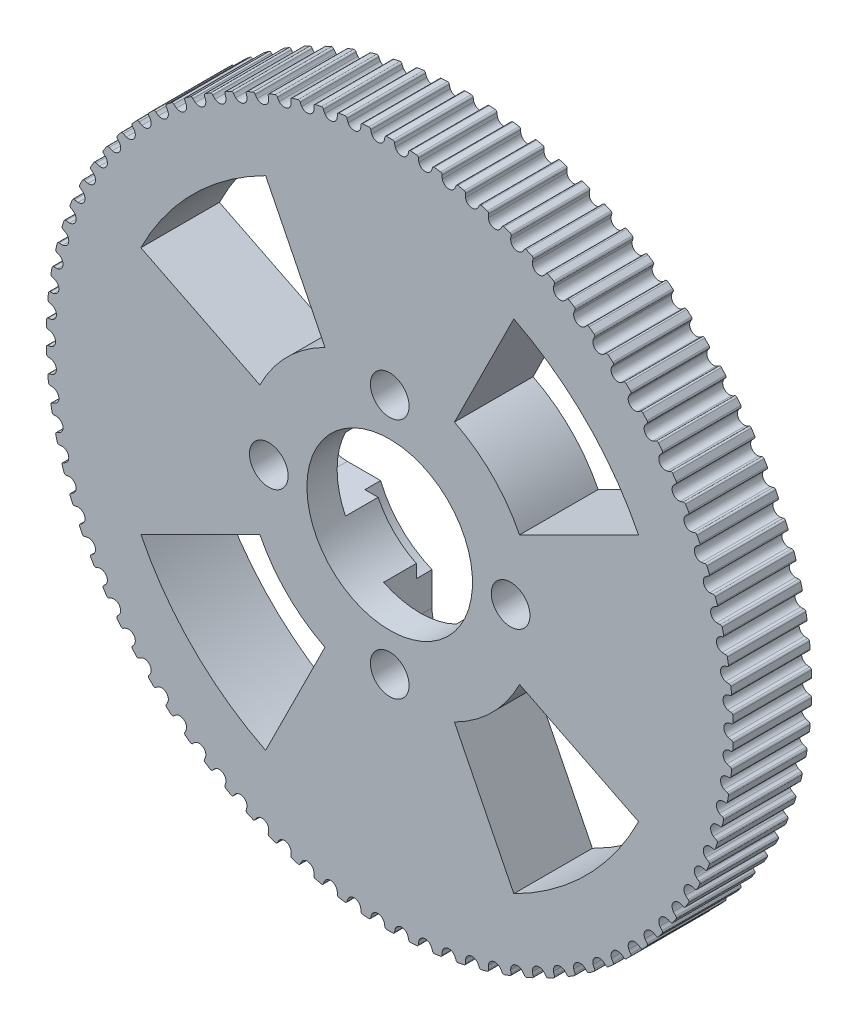
from build123d import *

# Parameters (mm, degrees)
EXTRUDE_1_DEPTH     = 6.5
SKETCH_2_R          = 7.85
CUT_EXTRUDE_1_DEPTH = 1.3
CUT_EXTRUDE_2_DEPTH = 4
SKETCH_4_R          = 6.85
CUT_EXTRUDE_3_DEPTH = 41.68598643
SKETCH_5_R          = 1.6
CUT_EXTRUDE_4_DEPTH = 41.68598643
CUT_EXTRUDE_5_DEPTH = 41.68598643


with BuildPart() as part:
    # 草图1 → 凸台-拉伸1 (new body)
    with BuildSketch(Plane.XY):
        with BuildLine():
            Line((-10.005707242, 26.144812388), (-10.00567226, 26.138581073))
            ThreePointArc((-10.00567226, 26.138581073), (-10.355657709, 25.622834978), (-10.96420932, 25.757552411))
            ThreePointArc((-10.96420932, 25.757552411), (-11.052436125, 25.865080775), (-11.124889477, 25.983810846))
            ThreePointArc((-11.124889477, 25.983810846), (-11.207844337, 26.056115388), (-11.317822783, 26.052347526))
            ThreePointArc((-11.317822783, 26.052347526), (-11.553167652, 25.948839399), (-11.787565637, 25.843204533))
            ThreePointArc((-11.787565637, 25.843204533), (-11.863955647, 25.763995811), (-11.865730536, 25.653967156))
            ThreePointArc((-11.865730536, 25.653967156), (-11.825977654, 25.520677897), (-11.805103762, 25.383162085))
            ThreePointArc((-11.805103762, 25.383162085), (-11.803737806, 25.36071627), (-11.803282238, 25.338233546))
            ThreePointArc((-11.803282238, 25.338233546), (-12.135393298, 24.829956534), (-12.734257086, 24.929983729))
            ThreePointArc((-12.734257086, 24.929983729), (-12.829769774, 25.031095768), (-12.910328826, 25.144482529))
            ThreePointArc((-12.910328826, 25.144482529), (-12.99812532, 25.210824301), (-13.107573031, 25.19939391))
            ThreePointArc((-13.107573031, 25.19939391), (-13.335124251, 25.079721095), (-13.561582538, 24.957992773))
            ThreePointArc((-13.561582538, 24.957992773), (-13.632261145, 24.873648302), (-13.626356499, 24.763763861))
            ThreePointArc((-13.626356499, 24.763763861), (-13.577402664, 24.633572309), (-13.546987002, 24.497847567))
            ThreePointArc((-13.546987002, 24.497847567), (-13.542261924, 24.456263042), (-13.540683906, 24.414440692))
            ThreePointArc((-13.540683906, 24.414440692), (-13.855192133, 23.914252021), (-14.442264831, 23.980958671))
            ThreePointArc((-14.442264831, 23.980958671), (-14.544598075, 24.075161779), (-14.632870349, 24.182652819))
            ThreePointArc((-14.632870349, 24.182652819), (-14.725080744, 24.242708613), (-14.833464502, 24.223671379))
            ThreePointArc((-14.833464502, 24.223671379), (-15.052113464, 24.08841691), (-15.269528772, 23.951188181))
            ThreePointArc((-15.269528772, 23.951188181), (-15.334151637, 23.862118879), (-15.320596224, 23.752913998))
            ThreePointArc((-15.320596224, 23.752913998), (-15.262679934, 23.626454433), (-15.222870683, 23.493181998))
            ThreePointArc((-15.222870683, 23.493181998), (-15.212787547, 23.432814159), (-15.209412821, 23.371703138))
            ThreePointArc((-15.209412821, 23.371703138), (-15.506611215, 22.880212211), (-16.079911314, 22.915100794))
            ThreePointArc((-16.079911314, 22.915100794), (-16.188566555, 23.001936021), (-16.284121998, 23.103007656))
            ThreePointArc((-16.284121998, 23.103007656), (-16.380297053, 23.156484885), (-16.487088823, 23.129933556))
            ThreePointArc((-16.487088823, 23.129933556), (-16.695770293, 22.97975638), (-16.903083396, 22.827695808))
            ThreePointArc((-16.903083396, 22.827695808), (-16.961335683, 22.734335611), (-16.940195543, 22.626342325))
            ThreePointArc((-16.940195543, 22.626342325), (-16.873598961, 22.504230845), (-16.824590069, 22.374060009))
            ThreePointArc((-16.824590069, 22.374060009), (-16.807182605, 22.295426233), (-16.8013391, 22.215100995))
            ThreePointArc((-16.8013391, 22.215100995), (-17.081541753, 21.732906617), (-17.639218084, 21.737602849))
            ThreePointArc((-17.639218084, 21.737602849), (-17.753665966, 21.816647143), (-17.856039042, 21.910806962))
            ThreePointArc((-17.856039042, 21.910806962), (-17.955710203, 21.957445091), (-18.060389707, 21.923509022))
            ThreePointArc((-18.060389707, 21.923509022), (-18.258087009, 21.759140787), (-18.454287897, 21.592989196))
            ThreePointArc((-18.454287897, 21.592989196), (-18.505885806, 21.495792946), (-18.477263932, 21.389537388))
            ThreePointArc((-18.477263932, 21.389537388), (-18.40231151, 21.272368908), (-18.344341742, 21.145933849))
            ThreePointArc((-18.344341742, 21.145933849), (-18.317688385, 21.049710705), (-18.308707039, 20.950269113))
            ThreePointArc((-18.308707039, 20.950269113), (-18.57224875, 20.477958763), (-19.112588359, 20.454201488))
            ThreePointArc((-19.112588359, 20.454201488), (-19.232271303, 20.525069754), (-19.34096326, 20.61185902))
            ThreePointArc((-19.34096326, 20.61185902), (-19.443644938, 20.651430831), (-19.545702187, 20.610275356))
            ThreePointArc((-19.545702187, 20.610275356), (-19.73145216, 20.432516847), (-19.915584964, 20.25308371))
            ThreePointArc((-19.915584964, 20.25308371), (-19.960277115, 20.152524937), (-19.924312949, 20.048524773))
            ThreePointArc((-19.924312949, 20.048524773), (-19.841369848, 19.936870127), (-19.774721627, 19.814786824))
            ThreePointArc((-19.774721627, 19.814786824), (-19.736957322, 19.701806417), (-19.724172894, 19.583369626))
            ThreePointArc((-19.724172894, 19.583369626), (-19.971408761, 19.121518743), (-20.492844023, 19.071149314))
            ThreePointArc((-20.492844023, 19.071149314), (-20.617178946, 19.133496288), (-20.731660248, 19.212492171))
            ThreePointArc((-20.731660248, 19.212492171), (-20.836852188, 19.244804877), (-20.935789971, 19.1966305))
            ThreePointArc((-20.935789971, 19.1966305), (-21.108687659, 19.006347739), (-21.279855302, 18.814507238))
            ThreePointArc((-21.279855302, 18.814507238), (-21.31742396, 18.711075854), (-21.274292716, 18.609837763))
            ThreePointArc((-21.274292716, 18.609837763), (-21.183763025, 18.504240919), (-21.108761056, 18.38710415))
            ThreePointArc((-21.108761056, 18.38710415), (-21.058088772, 18.258349624), (-21.040840657, 18.121061932))
            ThreePointArc((-21.040840657, 18.121061932), (-21.272145643, 17.670233208), (-21.773260612, 17.595184417))
            ThreePointArc((-21.773260612, 17.595184417), (-21.901641766, 17.648706351), (-22.021354672, 17.719523993))
            ThreePointArc((-22.021354672, 17.719523993), (-22.12854439, 17.744420167), (-22.223880691, 17.68946159))
            ThreePointArc((-22.223880691, 17.68946159), (-22.383083754, 17.487581614), (-22.540452325, 17.284268376))
            ThreePointArc((-22.540452325, 17.284268376), (-22.570714459, 17.178468288), (-22.520626268, 17.080485492))
            ThreePointArc((-22.520626268, 17.080485492), (-22.42295104, 16.981460909), (-22.339960724, 16.869841352))
            ThreePointArc((-22.339960724, 16.869841352), (-22.274662627, 16.726441575), (-22.252295657, 16.570470244))
            ThreePointArc((-22.252295657, 16.570470244), (-22.468064133, 16.131212947), (-22.947600064, 16.03349755))
            ThreePointArc((-22.947600064, 16.03349755), (-23.079401989, 16.077933691), (-23.203763269, 16.140228075))
            ThreePointArc((-23.203763269, 16.140228075), (-23.312428549, 16.157586426), (-23.403698898, 16.096111401))
            ThreePointArc((-23.403698898, 16.096111401), (-23.548431716, 15.88361775), (-23.69123453, 15.669822296))
            ThreePointArc((-23.69123453, 15.669822296), (-23.714042706, 15.562168953), (-23.657241593, 15.467918813))
            ThreePointArc((-23.657241593, 15.467918813), (-23.552896691, 15.375948929), (-23.462322348, 15.270390383))
            ThreePointArc((-23.462322348, 15.270390383), (-23.380770561, 15.113613833), (-23.352635803, 14.93914889))
            ThreePointArc((-23.352635803, 14.93914889), (-23.553281071, 14.511998186), (-24.010141114, 14.393697095))
            ThreePointArc((-24.010141114, 14.393697095), (-24.144721685, 14.428830954), (-24.273125464, 14.482298587))
            ThreePointArc((-24.273125464, 14.482298587), (-24.382736898, 14.492034548), (-24.469496636, 14.424342575))
            ThreePointArc((-24.469496636, 14.424342575), (-24.599054084, 14.202270498), (-24.72659542, 13.979034418))
            ThreePointArc((-24.72659542, 13.979034418), (-24.741838519, 13.870052294), (-24.678601213, 13.779993988))
            ThreePointArc((-24.678601213, 13.779993988), (-24.568094996, 13.695526871), (-24.470377896, 13.596543607))
            ThreePointArc((-24.470377896, 13.596543607), (-24.3710448, 13.427791501), (-24.336500352, 13.235045506))
            ThreePointArc((-24.336500352, 13.235045506), (-24.522454138, 12.820521812), (-24.955707171, 12.683771994))
            ThreePointArc((-24.955707171, 12.683771994), (-25.092410725, 12.709432403), (-25.224231432, 12.753812797))
            ThreePointArc((-25.224231432, 12.753812797), (-25.334255004, 12.755878934), (-25.416081447, 12.682299802))
            ThreePointArc((-25.416081447, 12.682299802), (-25.529832335, 12.45173121), (-25.641490825, 12.220142088))
            ThreePointArc((-25.641490825, 12.220142088), (-25.649094584, 12.110362135), (-25.579729172, 12.024934418))
            ThreePointArc((-25.579729172, 12.024934418), (-25.463600013, 11.948381582), (-25.359216223, 11.856455836))
            ThreePointArc((-25.359216223, 11.856455836), (-25.240684247, 11.677254525), (-25.199096013, 11.466462308))
            ThreePointArc((-25.199096013, 11.466462308), (-25.370807944, 11.065070659), (-25.779691532, 10.91205283))
            ThreePointArc((-25.779691532, 10.91205283), (-25.917852062, 10.928114774), (-26.052447481, 10.963191711))
            ThreePointArc((-26.052447481, 10.963191711), (-26.162347167, 10.957577959), (-26.238841664, 10.878470138))
            ThreePointArc((-26.238841664, 10.878470138), (-26.336231808, 10.64052834), (-26.431463463, 10.401714455))
            ThreePointArc((-26.431463463, 10.401714455), (-26.431390837, 10.291671508), (-26.356235259, 10.211290576))
            ThreePointArc((-26.356235259, 10.211290576), (-26.235048929, 10.143024979), (-26.124506997, 10.058604605))
            ThreePointArc((-26.124506997, 10.058604605), (-25.985477839, 9.87059728), (-25.936220307, 9.64201566))
            ThreePointArc((-25.936220307, 9.64201566), (-26.09415736, 9.254245089), (-26.478079825, 9.087171243))
            ThreePointArc((-26.478079825, 9.087171243), (-26.617024228, 9.093556469), (-26.753738622, 9.11915906))
            ThreePointArc((-26.753738622, 9.11915906), (-26.862979003, 9.105892767), (-26.93376888, 9.021641663))
            ThreePointArc((-26.93376888, 9.021641663), (-27.014323806, 8.777485885), (-27.092664667, 8.532610714))
            ThreePointArc((-27.092664667, 8.532610714), (-27.084916011, 8.422840893), (-27.004336417, 8.347898352))
            ThreePointArc((-27.004336417, 8.347898352), (-26.878683324, 8.288252578), (-26.762521799, 8.211748863))
            ThreePointArc((-26.762521799, 8.211748863), (-26.601825038, 8.016686612), (-26.544282038, 7.770594081))
            ThreePointArc((-26.544282038, 7.770594081), (-26.688927973, 7.396917026), (-27.047469576, 7.21801787))
            ThreePointArc((-27.047469576, 7.21801787), (-27.186520928, 7.214695271), (-27.32468824, 7.23069878))
            ThreePointArc((-27.32468824, 7.23069878), (-27.432737106, 7.20984458), (-27.497477483, 7.120860655))
            ThreePointArc((-27.497477483, 7.120860655), (-27.560804735, 6.871680401), (-27.621873133, 6.621936951))
            ThreePointArc((-27.621873133, 6.621936951), (-27.606486196, 6.512975043), (-27.520875163, 6.443836007))
            ThreePointArc((-27.520875163, 6.443836007), (-27.391367475, 6.393100643), (-27.270152285, 6.324886306))
            ThreePointArc((-27.270152285, 6.324886306), (-27.086753334, 6.124618566), (-27.020318791, 5.861314949))
            ThreePointArc((-27.020318791, 5.861314949), (-27.152173562, 5.502186677), (-27.485086774, 5.31369904))
            ThreePointArc((-27.485086774, 5.31369904), (-27.623567631, 5.300684802), (-27.762514722, 5.307011264))
            ThreePointArc((-27.762514722, 5.307011264), (-27.868845671, 5.278670755), (-27.927221138, 5.185387531))
            ThreePointArc((-27.927221138, 5.185387531), (-27.973012193, 4.932396781), (-28.016510609, 4.679001778))
            ThreePointArc((-28.016510609, 4.679001778), (-27.993560355, 4.571378634), (-27.903334971, 4.508379941))
            ThreePointArc((-27.903334971, 4.508379941), (-27.770603638, 4.466802166), (-27.64492533, 4.40720954))
            ThreePointArc((-27.64492533, 4.40720954), (-27.43793269, 4.203673987), (-27.362011361, 3.923480079))
            ThreePointArc((-27.362011361, 3.923480079), (-27.481590505, 3.579338134), (-27.78879939, 3.383492403))
            ThreePointArc((-27.78879939, 3.383492403), (-27.926035088, 3.36084993), (-28.065085022, 3.357468522))
            ThreePointArc((-28.065085022, 3.357468522), (-28.169180021, 3.321779778), (-28.22090618, 3.22465172))
            ThreePointArc((-28.22090618, 3.22465172), (-28.248937947, 2.96908302), (-28.274654462, 2.713270978))
            ThreePointArc((-28.274654462, 2.713270978), (-28.244252702, 2.607510927), (-28.149852535, 2.550959501))
            ThreePointArc((-28.149852535, 2.550959501), (-28.01454421, 2.518741877), (-27.885015077, 2.468061292))
            ThreePointArc((-27.885015077, 2.468061292), (-27.653686855, 2.263273235), (-27.567695059, 1.966530409))
            ThreePointArc((-27.567695059, 1.966530409), (-27.675529069, 1.637794075), (-27.95712777, 1.436801731))
            ThreePointArc((-27.95712777, 1.436801731), (-28.092449708, 1.404641336), (-28.230925049, 1.391568531))
            ThreePointArc((-28.230925049, 1.391568531), (-28.332276957, 1.348705423), (-28.377101803, 1.248205728))
            ThreePointArc((-28.377101803, 1.248205728), (-28.387237715, 0.991304184), (-28.395047039, 0.734321394))
            ThreePointArc((-28.395047039, 0.734321394), (-28.357341889, 0.63093969), (-28.259226848, 0.581111042))
            ThreePointArc((-28.259226848, 0.581111042), (-28.122000739, 0.55841053), (-27.989251833, 0.516888896))
            ThreePointArc((-27.989251833, 0.516888896), (-27.733001492, 0.312930209), (-27.636367814, 0))
            ThreePointArc((-27.636367814, 0), (-27.733001493, -0.312930209), (-27.989251834, -0.516888896))
            ThreePointArc((-27.989251834, -0.516888896), (-28.12200074, -0.55841053), (-28.259226849, -0.581111042))
            ThreePointArc((-28.259226849, -0.581111042), (-28.357341889, -0.63093969), (-28.39504704, -0.734321395))
            ThreePointArc((-28.39504704, -0.734321395), (-28.387237716, -0.991304185), (-28.377101803, -1.248205729))
            ThreePointArc((-28.377101803, -1.248205729), (-28.332276958, -1.348705423), (-28.23092505, -1.391568531))
            ThreePointArc((-28.23092505, -1.391568531), (-28.092449709, -1.404641336), (-27.957127771, -1.43680173))
            ThreePointArc((-27.957127771, -1.43680173), (-27.675529069, -1.637794075), (-27.567695059, -1.966530409))
            ThreePointArc((-27.567695059, -1.966530409), (-27.653686855, -2.263273235), (-27.885015076, -2.468061291))
            ThreePointArc((-27.885015076, -2.468061291), (-28.01454421, -2.518741877), (-28.149852535, -2.550959501))
            ThreePointArc((-28.149852535, -2.550959501), (-28.244252702, -2.607510927), (-28.274654461, -2.713270978))
            ThreePointArc((-28.274654461, -2.713270978), (-28.248937947, -2.96908302), (-28.220906179, -3.224651719))
            ThreePointArc((-28.220906179, -3.224651719), (-28.169180021, -3.321779778), (-28.065085021, -3.357468522))
            ThreePointArc((-28.065085021, -3.357468522), (-27.926035087, -3.360849931), (-27.788799389, -3.383492403))
            ThreePointArc((-27.788799389, -3.383492403), (-27.481590504, -3.579338135), (-27.362011361, -3.923480079))
            ThreePointArc((-27.362011361, -3.923480079), (-27.437932689, -4.203673987), (-27.644925329, -4.40720954))
            ThreePointArc((-27.644925329, -4.40720954), (-27.770603637, -4.466802166), (-27.903334971, -4.508379941))
            ThreePointArc((-27.903334971, -4.508379941), (-27.993560355, -4.571378634), (-28.016510609, -4.679001778))
            ThreePointArc((-28.016510609, -4.679001778), (-27.973012192, -4.932396781), (-27.927221138, -5.18538753))
            ThreePointArc((-27.927221138, -5.18538753), (-27.868845671, -5.278670755), (-27.762514721, -5.307011264))
            ThreePointArc((-27.762514721, -5.307011264), (-27.62356763, -5.300684802), (-27.485086773, -5.31369904))
            ThreePointArc((-27.485086773, -5.31369904), (-27.152173561, -5.502186678), (-27.02031879, -5.861314949))
            ThreePointArc((-27.02031879, -5.861314949), (-27.086753333, -6.124618566), (-27.270152283, -6.324886306))
            ThreePointArc((-27.270152283, -6.324886306), (-27.391367474, -6.393100644), (-27.520875162, -6.443836007))
            ThreePointArc((-27.520875162, -6.443836007), (-27.606486195, -6.512975043), (-27.621873132, -6.621936951))
            ThreePointArc((-27.621873132, -6.621936951), (-27.560804734, -6.871680401), (-27.497477481, -7.120860655))
            ThreePointArc((-27.497477481, -7.120860655), (-27.432737105, -7.20984458), (-27.324688238, -7.23069878))
            ThreePointArc((-27.324688238, -7.23069878), (-27.186520927, -7.21469527), (-27.047469574, -7.21801787))
            ThreePointArc((-27.047469574, -7.21801787), (-26.688927972, -7.396917025), (-26.544282036, -7.770594081))
            ThreePointArc((-26.544282036, -7.770594081), (-26.601825037, -8.016686612), (-26.762521797, -8.211748863))
            ThreePointArc((-26.762521797, -8.211748863), (-26.878683322, -8.288252577), (-27.004336415, -8.347898351))
            ThreePointArc((-27.004336415, -8.347898351), (-27.084916009, -8.422840892), (-27.092664666, -8.532610713))
            ThreePointArc((-27.092664666, -8.532610713), (-27.014323805, -8.777485884), (-26.933768879, -9.021641662))
            ThreePointArc((-26.933768879, -9.021641662), (-26.862979002, -9.105892766), (-26.753738621, -9.119159059))
            ThreePointArc((-26.753738621, -9.119159059), (-26.617024227, -9.093556468), (-26.478079824, -9.087171242))
            ThreePointArc((-26.478079824, -9.087171242), (-26.094157358, -9.254245088), (-25.936220305, -9.64201566))
            ThreePointArc((-25.936220305, -9.64201566), (-25.985477837, -9.870597279), (-26.124506995, -10.058604604))
            ThreePointArc((-26.124506995, -10.058604604), (-26.235048927, -10.143024978), (-26.356235257, -10.211290575))
            ThreePointArc((-26.356235257, -10.211290575), (-26.431390835, -10.291671507), (-26.431463461, -10.401714453))
            ThreePointArc((-26.431463461, -10.401714453), (-26.336231806, -10.640528338), (-26.238841661, -10.878470137))
            ThreePointArc((-26.238841661, -10.878470137), (-26.162347165, -10.957577958), (-26.052447479, -10.96319171))
            ThreePointArc((-26.052447479, -10.96319171), (-25.91785206, -10.928114773), (-25.77969153, -10.912052829))
            ThreePointArc((-25.77969153, -10.912052829), (-25.370807942, -11.065070658), (-25.199096011, -11.466462307))
            ThreePointArc((-25.199096011, -11.466462307), (-25.240684244, -11.677254523), (-25.35921622, -11.856455834))
            ThreePointArc((-25.35921622, -11.856455834), (-25.46360001, -11.94838158), (-25.579729169, -12.024934416))
            ThreePointArc((-25.579729169, -12.024934416), (-25.649094582, -12.110362133), (-25.641490823, -12.220142087))
            ThreePointArc((-25.641490823, -12.220142087), (-25.529832333, -12.451731209), (-25.416081445, -12.6822998))
            ThreePointArc((-25.416081445, -12.6822998), (-25.334255002, -12.755878932), (-25.22423143, -12.753812795))
            ThreePointArc((-25.22423143, -12.753812795), (-25.092410723, -12.709432401), (-24.955707169, -12.683771993))
            ThreePointArc((-24.955707169, -12.683771993), (-24.522454137, -12.820521811), (-24.33650035, -13.235045504))
            ThreePointArc((-24.33650035, -13.235045504), (-24.371044798, -13.427791498), (-24.470377894, -13.596543605))
            ThreePointArc((-24.470377894, -13.596543605), (-24.568094995, -13.695526869), (-24.678601212, -13.779993987))
            ThreePointArc((-24.678601212, -13.779993987), (-24.741838518, -13.870052292), (-24.72659542, -13.979034415))
            ThreePointArc((-24.72659542, -13.979034415), (-24.599054084, -14.202270496), (-24.469496635, -14.424342573))
            ThreePointArc((-24.469496635, -14.424342573), (-24.382736897, -14.492034545), (-24.273125463, -14.482298585))
            ThreePointArc((-24.273125463, -14.482298585), (-24.144721684, -14.428830952), (-24.010141113, -14.393697092))
            ThreePointArc((-24.010141113, -14.393697092), (-23.55328107, -14.511998184), (-23.352635802, -14.939148888))
            ThreePointArc((-23.352635802, -14.939148888), (-23.380770559, -15.11361383), (-23.462322346, -15.27039038))
            ThreePointArc((-23.462322346, -15.27039038), (-23.552896689, -15.375948926), (-23.657241591, -15.46791881))
            ThreePointArc((-23.657241591, -15.46791881), (-23.714042704, -15.56216895), (-23.691234528, -15.669822294))
            ThreePointArc((-23.691234528, -15.669822294), (-23.548431714, -15.883617749), (-23.403698897, -16.096111399))
            ThreePointArc((-23.403698897, -16.096111399), (-23.312428547, -16.157586424), (-23.203763268, -16.140228072))
            ThreePointArc((-23.203763268, -16.140228072), (-23.079401988, -16.077933689), (-22.947600063, -16.033497548))
            ThreePointArc((-22.947600063, -16.033497548), (-22.468064132, -16.131212944), (-22.252295656, -16.570470241))
            ThreePointArc((-22.252295656, -16.570470241), (-22.274662627, -16.726441572), (-22.339960723, -16.869841349))
            ThreePointArc((-22.339960723, -16.869841349), (-22.422951039, -16.981460907), (-22.520626267, -17.080485489))
            ThreePointArc((-22.520626267, -17.080485489), (-22.570714458, -17.178468286), (-22.540452324, -17.284268374))
            ThreePointArc((-22.540452324, -17.284268374), (-22.383083754, -17.487581613), (-22.22388069, -17.689461588))
            ThreePointArc((-22.22388069, -17.689461588), (-22.12854439, -17.744420165), (-22.021354671, -17.719523991))
            ThreePointArc((-22.021354671, -17.719523991), (-21.901641766, -17.648706349), (-21.773260612, -17.595184415))
            ThreePointArc((-21.773260612, -17.595184415), (-21.272145642, -17.670233206), (-21.040840657, -18.121061929))
            ThreePointArc((-21.040840657, -18.121061929), (-21.058088772, -18.258349622), (-21.108761056, -18.387104147))
            ThreePointArc((-21.108761056, -18.387104147), (-21.183763025, -18.504240917), (-21.274292716, -18.60983776))
            ThreePointArc((-21.274292716, -18.60983776), (-21.31742396, -18.711075851), (-21.279855302, -18.814507235))
            ThreePointArc((-21.279855302, -18.814507235), (-21.108687659, -19.006347737), (-20.93578997, -19.196630498))
            ThreePointArc((-20.93578997, -19.196630498), (-20.836852188, -19.244804874), (-20.731660247, -19.21249217))
            ThreePointArc((-20.731660247, -19.21249217), (-20.617178945, -19.133496286), (-20.492844022, -19.071149312))
            ThreePointArc((-20.492844022, -19.071149312), (-19.97140876, -19.121518741), (-19.724172893, -19.583369624))
            ThreePointArc((-19.724172893, -19.583369624), (-19.736957321, -19.701806415), (-19.774721626, -19.814786821))
            ThreePointArc((-19.774721626, -19.814786821), (-19.841369846, -19.936870125), (-19.924312948, -20.048524771))
            ThreePointArc((-19.924312948, -20.048524771), (-19.960277115, -20.152524935), (-19.915584963, -20.253083708))
            ThreePointArc((-19.915584963, -20.253083708), (-19.731452159, -20.432516845), (-19.545702186, -20.610275354))
            ThreePointArc((-19.545702186, -20.610275354), (-19.443644937, -20.651430829), (-19.340963259, -20.611859017))
            ThreePointArc((-19.340963259, -20.611859017), (-19.232271302, -20.525069752), (-19.112588359, -20.454201486))
            ThreePointArc((-19.112588359, -20.454201486), (-18.57224875, -20.477958762), (-18.308707039, -20.950269111))
            ThreePointArc((-18.308707039, -20.950269111), (-18.317688385, -21.049710703), (-18.344341742, -21.145933846))
            ThreePointArc((-18.344341742, -21.145933846), (-18.40231151, -21.272368905), (-18.477263931, -21.389537385))
            ThreePointArc((-18.477263931, -21.389537385), (-18.505885806, -21.495792943), (-18.454287898, -21.592989193))
            ThreePointArc((-18.454287898, -21.592989193), (-18.258087009, -21.759140784), (-18.060389707, -21.92350902))
            ThreePointArc((-18.060389707, -21.92350902), (-17.955710203, -21.957445088), (-17.856039042, -21.91080696))
            ThreePointArc((-17.856039042, -21.91080696), (-17.753665966, -21.816647141), (-17.639218084, -21.737602846))
            ThreePointArc((-17.639218084, -21.737602846), (-17.081541753, -21.732906614), (-16.801339099, -22.215100993))
            ThreePointArc((-16.801339099, -22.215100993), (-16.807182604, -22.295426231), (-16.824590068, -22.374060007))
            ThreePointArc((-16.824590068, -22.374060007), (-16.873598961, -22.504230843), (-16.940195542, -22.626342323))
            ThreePointArc((-16.940195542, -22.626342323), (-16.961335683, -22.734335608), (-16.903083397, -22.827695806))
            ThreePointArc((-16.903083397, -22.827695806), (-16.695770294, -22.979756378), (-16.487088824, -23.129933554))
            ThreePointArc((-16.487088824, -23.129933554), (-16.380297054, -23.156484883), (-16.284121999, -23.103007654))
            ThreePointArc((-16.284121999, -23.103007654), (-16.188566556, -23.001936019), (-16.079911314, -22.915100791))
            ThreePointArc((-16.079911314, -22.915100791), (-15.506611215, -22.880212208), (-15.209412821, -23.371703136))
            ThreePointArc((-15.209412821, -23.371703136), (-15.212787547, -23.432814157), (-15.222870684, -23.493181997))
            ThreePointArc((-15.222870684, -23.493181997), (-15.262679935, -23.626454431), (-15.320596224, -23.752913996))
            ThreePointArc((-15.320596224, -23.752913996), (-15.334151638, -23.862118877), (-15.269528773, -23.951188179))
            ThreePointArc((-15.269528773, -23.951188179), (-15.052113465, -24.088416908), (-14.833464503, -24.223671377))
            ThreePointArc((-14.833464503, -24.223671377), (-14.725080745, -24.242708611), (-14.63287035, -24.182652818))
            ThreePointArc((-14.63287035, -24.182652818), (-14.544598076, -24.075161777), (-14.442264833, -23.98095867))
            ThreePointArc((-14.442264833, -23.98095867), (-13.855192134, -23.91425202), (-13.540683908, -24.414440691))
            ThreePointArc((-13.540683908, -24.414440691), (-13.542261925, -24.45626304), (-13.546987003, -24.497847565))
            ThreePointArc((-13.546987003, -24.497847565), (-13.577402665, -24.633572307), (-13.6263565, -24.76376386))
            ThreePointArc((-13.6263565, -24.76376386), (-13.632261145, -24.873648301), (-13.561582538, -24.957992771))
            ThreePointArc((-13.561582538, -24.957992771), (-13.335124251, -25.079721093), (-13.107573032, -25.199393908))
            ThreePointArc((-13.107573032, -25.199393908), (-12.998125321, -25.210824299), (-12.910328827, -25.144482527))
            ThreePointArc((-12.910328827, -25.144482527), (-12.829769775, -25.031095766), (-12.734257087, -24.929983727))
            ThreePointArc((-12.734257087, -24.929983727), (-12.135393299, -24.829956533), (-11.803282239, -25.338233544))
            ThreePointArc((-11.803282239, -25.338233544), (-11.803737807, -25.360716268), (-11.805103763, -25.383162082))
            ThreePointArc((-11.805103763, -25.383162082), (-11.825977655, -25.520677895), (-11.865730537, -25.653967154))
            ThreePointArc((-11.865730537, -25.653967154), (-11.863955648, -25.76399581), (-11.787565637, -25.843204531))
            ThreePointArc((-11.787565637, -25.843204531), (-11.553167653, -25.948839397), (-11.317822784, -26.052347525))
            ThreePointArc((-11.317822784, -26.052347525), (-11.207844337, -26.056115386), (-11.124889479, -25.983810845))
            ThreePointArc((-11.124889479, -25.983810845), (-11.052436126, -25.865080774), (-10.964209321, -25.75755241))
            ThreePointArc((-10.964209321, -25.75755241), (-10.355657711, -25.622834977), (-10.005672261, -26.138581072))
            Line((-10.005672261, -26.138581072), (-10.005707243, -26.144812386))
            ThreePointArc((-10.005707243, -26.144812386), (-10.016937669, -26.283449307), (-10.047295927, -26.419186901))
            ThreePointArc((-10.047295927, -26.419186901), (-10.03785015, -26.528823722), (-9.956120901, -26.602510797))
            ThreePointArc((-9.956120901, -26.602510797), (-9.714925182, -26.691537565), (-9.472933239, -26.778376724))
            ThreePointArc((-9.472933239, -26.778376724), (-9.362959863, -26.774463698), (-9.285250788, -26.696548649))
            ThreePointArc((-9.285250788, -26.696548649), (-9.221256118, -26.573053707), (-9.140745029, -26.459632886))
            ThreePointArc((-9.140745029, -26.459632886), (-8.540107317, -26.283747693), (-8.157563924, -26.779087792))
            ThreePointArc((-8.157563924, -26.779087792), (-8.15909617, -26.918170395), (-8.179911901, -27.055695024))
            ThreePointArc((-8.179911901, -27.055695024), (-8.162841256, -27.164405872), (-8.076170944, -27.232212305))
            ThreePointArc((-8.076170944, -27.232212305), (-7.829352573, -27.304197245), (-7.581892517, -27.373944363))
            ThreePointArc((-7.581892517, -27.373944363), (-7.472459989, -27.362369515), (-7.400375289, -27.279223551))
            ThreePointArc((-7.400375289, -27.279223551), (-7.345151079, -27.151565395), (-7.272747948, -27.032804692))
            ThreePointArc((-7.272747948, -27.032804692), (-6.68584249, -26.815449577), (-6.269677775, -27.282898175))
            ThreePointArc((-6.269677775, -27.282898175), (-6.261504377, -27.421748863), (-6.272676168, -27.560390521))
            ThreePointArc((-6.272676168, -27.560390521), (-6.248063821, -27.667645766), (-6.156874695, -27.729241211))
            ThreePointArc((-6.156874695, -27.729241211), (-5.905636146, -27.783833621), (-5.653913576, -27.836148897))
            ThreePointArc((-5.653913576, -27.836148897), (-5.545555041, -27.816968617), (-5.479445905, -27.728996819))
            ThreePointArc((-5.479445905, -27.728996819), (-5.433261202, -27.597797385), (-5.369318768, -27.47427539))
            ThreePointArc((-5.369318768, -27.47427539), (-4.799004909, -27.216509286), (-4.351246384, -27.65378902))
            ThreePointArc((-4.351246384, -27.65378902), (-4.333407162, -27.791731327), (-4.334880586, -27.930814566))
            ThreePointArc((-4.334880586, -27.930814566), (-4.302846445, -28.036091673), (-4.207582771, -28.091176042))
            ThreePointArc((-4.207582771, -28.091176042), (-3.953148052, -28.128109952), (-3.698389337, -28.162738512))
            ThreePointArc((-3.698389337, -28.162738512), (-3.591632706, -28.136046245), (-3.531821211, -28.043677201))
            ThreePointArc((-3.531821211, -28.043677201), (-3.494901021, -27.909575681), (-3.439730807, -27.78189418))
            ThreePointArc((-3.439730807, -27.78189418), (-2.888787058, -27.484972898), (-2.411616159, -27.889953384))
            ThreePointArc((-2.411616159, -27.889953384), (-2.384198023, -28.02631527), (-2.375965901, -28.16516249))
            ThreePointArc((-2.375965901, -28.16516249), (-2.336666035, -28.267948558), (-2.237791928, -28.316253486))
            ThreePointArc((-2.237791928, -28.316253486), (-1.981400619, -28.335348958), (-1.724846918, -28.352122095))
            ThreePointArc((-1.724846918, -28.352122095), (-1.620212299, -28.318047883), (-1.566989841, -28.221731606))
            ThreePointArc((-1.566989841, -28.221731606), (-1.539514036, -28.085381329), (-1.493384825, -27.954162374))
            ThreePointArc((-1.493384825, -27.954162374), (-0.964495329, -27.619532484), (-0.460236783, -27.990240698))
            ThreePointArc((-0.460236783, -27.990240698), (-0.423373312, -28.124357821), (-0.405475751, -28.262292572))
            ThreePointArc((-0.405475751, -28.262292572), (-0.359101624, -28.362086838), (-0.257098787, -28.40337699))
            ThreePointArc((-0.257098787, -28.40337699), (-2e-09, -28.404540993), (0.257098783, -28.40337699))
            ThreePointArc((0.257098783, -28.40337699), (0.359101619, -28.362086838), (0.405475746, -28.262292572))
            ThreePointArc((0.405475746, -28.262292572), (0.423373307, -28.124357821), (0.460236778, -27.990240698))
            ThreePointArc((0.460236778, -27.990240698), (0.964495324, -27.619532484), (1.49338482, -27.954162374))
            ThreePointArc((1.49338482, -27.954162374), (1.539514031, -28.085381329), (1.566989836, -28.221731606))
            ThreePointArc((1.566989836, -28.221731606), (1.620212294, -28.318047883), (1.724846913, -28.352122095))
            ThreePointArc((1.724846913, -28.352122095), (1.981400614, -28.335348958), (2.237791923, -28.316253486))
            ThreePointArc((2.237791923, -28.316253486), (2.33666603, -28.267948558), (2.375965897, -28.16516249))
            ThreePointArc((2.375965897, -28.16516249), (2.375925478, -28.15997167), (2.375912004, -28.15478071))
            ThreePointArc((2.375912004, -28.15478071), (2.384878238, -28.021169054), (2.411616154, -27.889953384))
            ThreePointArc((2.411616154, -27.889953384), (2.888787054, -27.484972898), (3.439730802, -27.78189418))
            ThreePointArc((3.439730802, -27.78189418), (3.494901016, -27.909575681), (3.531821206, -28.043677201))
            ThreePointArc((3.531821206, -28.043677201), (3.591632701, -28.136046245), (3.698389332, -28.162738512))
            ThreePointArc((3.698389332, -28.162738512), (3.953148047, -28.128109952), (4.207582766, -28.091176042))
            ThreePointArc((4.207582766, -28.091176042), (4.29901348, -28.040726261), (4.335362667, -27.942830947))
            ThreePointArc((4.335362667, -27.942830947), (4.335242097, -27.936817923), (4.334880581, -27.930814566))
            ThreePointArc((4.334880581, -27.930814566), (4.332470474, -27.890792185), (4.331666674, -27.850705362))
            ThreePointArc((4.331666674, -27.850705362), (4.336573639, -27.751761677), (4.351246379, -27.65378902))
            ThreePointArc((4.351246379, -27.65378902), (4.799004904, -27.216509287), (5.369318763, -27.47427539))
            ThreePointArc((5.369318763, -27.47427539), (5.433261197, -27.597797386), (5.4794459, -27.728996819))
            ThreePointArc((5.4794459, -27.728996819), (5.545555037, -27.816968618), (5.653913572, -27.836148898))
            ThreePointArc((5.653913572, -27.836148898), (5.905636141, -27.783833621), (6.156874691, -27.729241212))
            ThreePointArc((6.156874691, -27.729241212), (6.241358766, -27.676676796), (6.274360688, -27.582807474))
            ThreePointArc((6.274360688, -27.582807474), (6.273938964, -27.571567396), (6.272676163, -27.560390522))
            ThreePointArc((6.272676163, -27.560390522), (6.264257493, -27.485878025), (6.261446, -27.410944177))
            ThreePointArc((6.261446, -27.410944177), (6.263506064, -27.346789012), (6.26967777, -27.282898176))
            ThreePointArc((6.26967777, -27.282898176), (6.685842485, -26.815449578), (7.272747943, -27.032804692))
            ThreePointArc((7.272747943, -27.032804692), (7.345151075, -27.151565395), (7.400375284, -27.279223551))
            ThreePointArc((7.400375284, -27.279223551), (7.472459985, -27.362369515), (7.581892513, -27.373944364))
            ThreePointArc((7.581892513, -27.373944364), (7.829352569, -27.304197246), (8.07617094, -27.232212305))
            ThreePointArc((8.07617094, -27.232212305), (8.153724236, -27.178132301), (8.183521438, -27.088403335))
            ThreePointArc((8.183521438, -27.088403335), (8.182616322, -27.071949898), (8.179911897, -27.055695025))
            ThreePointArc((8.179911897, -27.055695025), (8.161882396, -26.947329204), (8.155848289, -26.837639626))
            ThreePointArc((8.155848289, -26.837639626), (8.156277289, -26.808351145), (8.15756392, -26.779087793))
            ThreePointArc((8.15756392, -26.779087793), (8.540107313, -26.283747694), (9.140745025, -26.459632887))
            ThreePointArc((9.140745025, -26.459632887), (9.221256114, -26.573053708), (9.285250783, -26.69654865))
            ThreePointArc((9.285250783, -26.69654865), (9.362959858, -26.774463699), (9.472933235, -26.778376724))
            ThreePointArc((9.472933235, -26.778376724), (9.714925178, -26.691537566), (9.956120897, -26.602510798))
            ThreePointArc((9.956120897, -26.602510798), (10.026804749, -26.547506506), (10.05354368, -26.462027218))
            ThreePointArc((10.05354368, -26.462027218), (10.051973522, -26.440380468), (10.047295923, -26.419186902))
            ThreePointArc((10.047295923, -26.419186902), (10.016937665, -26.283449308), (10.005707239, -26.144812387))
            ThreePointArc((10.005707239, -26.144812387), (10.352765598, -25.623994033), (10.964209317, -25.757552411))
            ThreePointArc((10.964209317, -25.757552411), (11.052436122, -25.865080774), (11.124889474, -25.983810845))
            ThreePointArc((11.124889474, -25.983810845), (11.207844333, -26.056115387), (11.317822779, -26.052347525))
            ThreePointArc((11.317822779, -26.052347525), (11.553167649, -25.948839398), (11.787565633, -25.843204532))
            ThreePointArc((11.787565633, -25.843204532), (11.851486019, -25.787856231), (11.875316852, -25.706730764))
            ThreePointArc((11.875316852, -25.706730764), (11.872900815, -25.679917074), (11.865730533, -25.653967155))
            ThreePointArc((11.865730533, -25.653967155), (11.82597765, -25.520677896), (11.805103758, -25.383162083))
            ThreePointArc((11.805103758, -25.383162083), (12.114986248, -24.839402849), (12.734257083, -24.929983727))
            ThreePointArc((12.734257083, -24.929983727), (12.829769771, -25.031095767), (12.910328822, -25.144482527))
            ThreePointArc((12.910328822, -25.144482527), (12.998125317, -25.2108243), (13.107573027, -25.199393909))
            ThreePointArc((13.107573027, -25.199393909), (13.335124247, -25.079721094), (13.561582534, -24.957992772))
            ThreePointArc((13.561582534, -24.957992772), (13.618889005, -24.90286651), (13.63996546, -24.826193702))
            ThreePointArc((13.63996546, -24.826193702), (13.636523734, -24.794245741), (13.626356496, -24.76376386))
            ThreePointArc((13.626356496, -24.76376386), (13.577402661, -24.633572308), (13.546986999, -24.497847565))
            ThreePointArc((13.546986999, -24.497847565), (13.818183904, -23.933796592), (14.442264828, -23.98095867))
            ThreePointArc((14.442264828, -23.98095867), (14.544598071, -24.075161778), (14.632870345, -24.182652818))
            ThreePointArc((14.632870345, -24.182652818), (14.72508074, -24.242708612), (14.833464498, -24.223671378))
            ThreePointArc((14.833464498, -24.223671378), (15.052113461, -24.088416909), (15.269528768, -23.95118818))
            ThreePointArc((15.269528768, -23.95118818), (15.320413162, -23.896832655), (15.338892311, -23.824705922))
            ThreePointArc((15.338892311, -23.824705922), (15.334246338, -23.787662611), (15.320596219, -23.752913997))
            ThreePointArc((15.320596219, -23.752913997), (15.26267993, -23.626454432), (15.222870679, -23.493181998))
            ThreePointArc((15.222870679, -23.493181998), (15.454060755, -22.911587284), (16.07991131, -22.915100792))
            ThreePointArc((16.07991131, -22.915100792), (16.188566552, -23.00193602), (16.284121995, -23.103007655))
            ThreePointArc((16.284121995, -23.103007655), (16.38029705, -23.156484884), (16.48708882, -23.129933555))
            ThreePointArc((16.48708882, -23.129933555), (16.69577029, -22.979756379), (16.903083393, -22.827695806))
            ThreePointArc((16.903083393, -22.827695806), (16.947778324, -22.774639352), (16.963820405, -22.707146567))
            ThreePointArc((16.963820405, -22.707146567), (16.957793094, -22.66505304), (16.940195538, -22.626342323))
            ThreePointArc((16.940195538, -22.626342323), (16.873598957, -22.504230843), (16.824590064, -22.374060007))
            ThreePointArc((16.824590064, -22.374060007), (17.014646976, -21.777755025), (17.63921808, -21.737602847))
            ThreePointArc((17.63921808, -21.737602847), (17.753665962, -21.816647141), (17.856039038, -21.91080696))
            ThreePointArc((17.856039038, -21.91080696), (17.955710199, -21.957445089), (18.060389703, -21.92350902))
            ThreePointArc((18.060389703, -21.92350902), (18.258087005, -21.759140785), (18.454287893, -21.592989194))
            ThreePointArc((18.454287893, -21.592989194), (18.493065036, -21.541736883), (18.506833256, -21.478960278))
            ThreePointArc((18.506833256, -21.478960278), (18.499249197, -21.431867819), (18.477263927, -21.389537386))
            ThreePointArc((18.477263927, -21.389537386), (18.402311505, -21.272368906), (18.344341738, -21.145933847))
            ThreePointArc((18.344341738, -21.145933847), (18.492339548, -20.537823734), (19.112588354, -20.454201487))
            ThreePointArc((19.112588354, -20.454201487), (19.232271298, -20.525069753), (19.340963255, -20.611859019))
            ThreePointArc((19.340963255, -20.611859019), (19.443644932, -20.65143083), (19.545702182, -20.610275355))
            ThreePointArc((19.545702182, -20.610275355), (19.731452154, -20.432516846), (19.915584958, -20.25308371))
            ThreePointArc((19.915584958, -20.25308371), (19.948753124, -20.204114597), (19.960413461, -20.146130654))
            ThreePointArc((19.960413461, -20.146130654), (19.951099143, -20.094096637), (19.924312943, -20.048524773))
            ThreePointArc((19.924312943, -20.048524773), (19.841369842, -19.936870126), (19.774721621, -19.814786822))
            ThreePointArc((19.774721621, -19.814786822), (19.879939299, -19.19783423), (20.492844017, -19.071149313))
            ThreePointArc((20.492844017, -19.071149313), (20.61717894, -19.133496287), (20.731660242, -19.212492171))
            ThreePointArc((20.731660242, -19.212492171), (20.836852183, -19.244804876), (20.935789966, -19.196630499))
            ThreePointArc((20.935789966, -19.196630499), (21.108687654, -19.006347738), (21.279855297, -18.814507236))
            ThreePointArc((21.279855297, -18.814507236), (21.307758324, -18.768271742), (21.317479324, -18.715151105))
            ThreePointArc((21.317479324, -18.715151105), (21.306263343, -18.658238928), (21.274292711, -18.609837761))
            ThreePointArc((21.274292711, -18.609837761), (21.18376302, -18.504240918), (21.108761051, -18.387104149))
            ThreePointArc((21.108761051, -18.387104149), (21.170685987, -17.764314807), (21.773260607, -17.595184417))
            ThreePointArc((21.773260607, -17.595184417), (21.901641761, -17.648706351), (22.021354666, -17.719523993))
            ThreePointArc((22.021354666, -17.719523993), (22.128544385, -17.744420166), (22.223880685, -17.68946159))
            ThreePointArc((22.223880685, -17.68946159), (22.383083749, -17.487581614), (22.540452319, -17.284268376))
            ThreePointArc((22.540452319, -17.284268376), (22.563466785, -17.241185833), (22.571419355, -17.192993223))
            ThreePointArc((22.571419355, -17.192993223), (22.558132624, -17.131272221), (22.520626262, -17.080485491))
            ThreePointArc((22.520626262, -17.080485491), (22.422951034, -16.981460908), (22.339960718, -16.869841351))
            ThreePointArc((22.339960718, -16.869841351), (22.358291219, -16.244249428), (22.947600057, -16.03349755))
            ThreePointArc((22.947600057, -16.03349755), (23.079401983, -16.077933691), (23.203763262, -16.140228074))
            ThreePointArc((23.203763262, -16.140228074), (23.312428542, -16.157586426), (23.403698891, -16.096111401))
            ThreePointArc((23.403698891, -16.096111401), (23.548431709, -15.88361775), (23.691234523, -15.669822296))
            ThreePointArc((23.691234523, -15.669822296), (23.709767281, -15.630278674), (23.716124484, -15.587072805))
            ThreePointArc((23.716124484, -15.587072805), (23.70060044, -15.520618178), (23.657241585, -15.467918812))
            ThreePointArc((23.657241585, -15.467918812), (23.552896683, -15.375948928), (23.46232234, -15.270390382))
            ThreePointArc((23.46232234, -15.270390382), (23.436969103, -14.645043698), (24.010141108, -14.393697094))
            ThreePointArc((24.010141108, -14.393697094), (24.144721679, -14.428830953), (24.273125458, -14.482298586))
            ThreePointArc((24.273125458, -14.482298586), (24.382736891, -14.492034547), (24.46949663, -14.424342575))
            ThreePointArc((24.46949663, -14.424342575), (24.599054078, -14.202270497), (24.726595415, -13.979034417))
            ThreePointArc((24.726595415, -13.979034417), (24.741080981, -13.943380223), (24.746017825, -13.905213735))
            ThreePointArc((24.746017825, -13.905213735), (24.728092628, -13.834106447), (24.678601207, -13.779993988))
            ThreePointArc((24.678601207, -13.779993988), (24.568094989, -13.69552687), (24.470377889, -13.596543606))
            ThreePointArc((24.470377889, -13.596543606), (24.401464431, -12.974488788), (24.955707164, -12.683771994))
            ThreePointArc((24.955707164, -12.683771994), (25.092410717, -12.709432403), (25.224231425, -12.753812796))
            ThreePointArc((25.224231425, -12.753812796), (25.334254997, -12.755878934), (25.416081439, -12.682299802))
            ThreePointArc((25.416081439, -12.682299802), (25.529832327, -12.45173121), (25.641490817, -12.220142088))
            ThreePointArc((25.641490817, -12.220142088), (25.652388617, -12.188690468), (25.656081838, -12.155609861))
            ThreePointArc((25.656081838, -12.155609861), (25.635594577, -12.079936547), (25.579729164, -12.024934418))
            ThreePointArc((25.579729164, -12.024934418), (25.463600005, -11.948381582), (25.359216215, -11.856455836))
            ThreePointArc((25.359216215, -11.856455836), (25.247078276, -11.240723472), (25.779691524, -10.912052831))
            ThreePointArc((25.779691524, -10.912052831), (25.917852055, -10.928114775), (26.052447473, -10.963191712))
            ThreePointArc((26.052447473, -10.963191712), (26.16234716, -10.95757796), (26.238841656, -10.878470139))
            ThreePointArc((26.238841656, -10.878470139), (26.336231801, -10.64052834), (26.431463456, -10.401714455))
            ThreePointArc((26.431463456, -10.401714455), (26.439254934, -10.3747395), (26.441882785, -10.346785079))
            ThreePointArc((26.441882785, -10.346785079), (26.418675667, -10.266637932), (26.356235251, -10.211290576))
            ThreePointArc((26.356235251, -10.211290576), (26.235048921, -10.14302498), (26.124506989, -10.058604606))
            ThreePointArc((26.124506989, -10.058604606), (25.969690895, -9.452194482), (26.478079818, -9.087171244))
            ThreePointArc((26.478079818, -9.087171244), (26.617024221, -9.09355647), (26.753738615, -9.11915906))
            ThreePointArc((26.753738615, -9.11915906), (26.862978996, -9.105892768), (26.933768873, -9.021641664))
            ThreePointArc((26.933768873, -9.021641664), (27.014323799, -8.777485886), (27.09266466, -8.532610715))
            ThreePointArc((27.09266466, -8.532610715), (27.097850291, -8.510345978), (27.099592322, -8.487551799))
            ThreePointArc((27.099592322, -8.487551799), (27.07351087, -8.403028468), (27.004336409, -8.347898353))
            ThreePointArc((27.004336409, -8.347898353), (26.878683316, -8.288252579), (26.762521792, -8.211748864))
            ThreePointArc((26.762521792, -8.211748864), (26.565781789, -7.61761535), (27.047469569, -7.218017871))
            ThreePointArc((27.047469569, -7.218017871), (27.186520921, -7.214695272), (27.324688233, -7.230698781))
            ThreePointArc((27.324688233, -7.230698781), (27.432737099, -7.209844581), (27.497477476, -7.120860657))
            ThreePointArc((27.497477476, -7.120860657), (27.560804728, -6.871680402), (27.621873127, -6.621936953))
            ThreePointArc((27.621873127, -6.621936953), (27.624969314, -6.604574185), (27.626006154, -6.58696802))
            ThreePointArc((27.626006154, -6.58696802), (27.596899393, -6.498171484), (27.520875156, -6.443836009))
            ThreePointArc((27.520875156, -6.443836009), (27.391367468, -6.393100645), (27.270152278, -6.324886308))
            ThreePointArc((27.270152278, -6.324886308), (27.032446866, -5.745923962), (27.485086767, -5.313699042))
            ThreePointArc((27.485086767, -5.313699042), (27.623567624, -5.300684804), (27.762514715, -5.307011266))
            ThreePointArc((27.762514715, -5.307011266), (27.868845665, -5.278670757), (27.927221132, -5.185387531))
            ThreePointArc((27.927221132, -5.185387531), (27.973012187, -4.932396782), (28.016510603, -4.679001779))
            ThreePointArc((28.016510603, -4.679001779), (28.018046507, -4.666689895), (28.018559645, -4.654293194))
            ThreePointArc((28.018559645, -4.654293194), (27.986280285, -4.561331637), (27.903334964, -4.508379942))
            ThreePointArc((27.903334964, -4.508379942), (27.770603631, -4.466802167), (27.644925323, -4.407209541))
            ThreePointArc((27.644925323, -4.407209541), (27.367412576, -3.846239009), (27.788799383, -3.383492404))
            ThreePointArc((27.788799383, -3.383492404), (27.926035081, -3.360849932), (28.065085015, -3.357468523))
            ThreePointArc((28.065085015, -3.357468523), (28.169180015, -3.321779779), (28.220906173, -3.22465172))
            ThreePointArc((28.220906173, -3.22465172), (28.248937941, -2.969083021), (28.274654455, -2.713270979))
            ThreePointArc((28.274654455, -2.713270979), (28.275168752, -2.706115253), (28.275340315, -2.69894312))
            ThreePointArc((28.275340315, -2.69894312), (28.239744931, -2.601929802), (28.149852529, -2.550959502))
            ThreePointArc((28.149852529, -2.550959502), (28.014544204, -2.518741878), (27.88501507, -2.468061292))
            ThreePointArc((27.88501507, -2.468061292), (27.569047005, -1.927815567), (27.957127764, -1.436801731))
            ThreePointArc((27.957127764, -1.436801731), (28.092449703, -1.404641337), (28.230925043, -1.391568532))
            ThreePointArc((28.230925043, -1.391568532), (28.332276951, -1.348705424), (28.377101797, -1.24820573))
            ThreePointArc((28.377101797, -1.24820573), (28.387237709, -0.991304186), (28.395047034, -0.734321396))
            ThreePointArc((28.395047034, -0.734321396), (28.395084624, -0.732382893), (28.395097154, -0.730444067))
            ThreePointArc((28.395097154, -0.730444067), (28.356046362, -0.629497183), (28.259226843, -0.581111043))
            ThreePointArc((28.259226843, -0.581111043), (28.122000738, -0.55841053), (27.989251835, -0.516888896))
            ThreePointArc((27.989251835, -0.516888896), (27.636367815, 0), (27.989251835, 0.516888895))
            ThreePointArc((27.989251835, 0.516888895), (28.122000741, 0.55841053), (28.25922685, 0.581111042))
            ThreePointArc((28.25922685, 0.581111042), (28.356046369, 0.629497181), (28.395097161, 0.730444065))
            ThreePointArc((28.395097161, 0.730444065), (28.39508463, 0.732382891), (28.39504704, 0.734321394))
            ThreePointArc((28.39504704, 0.734321394), (28.387237716, 0.991304184), (28.377101804, 1.248205728))
            ThreePointArc((28.377101804, 1.248205728), (28.332276958, 1.348705423), (28.23092505, 1.391568531))
            ThreePointArc((28.23092505, 1.391568531), (28.09244971, 1.404641336), (27.957127771, 1.43680173))
            ThreePointArc((27.957127771, 1.43680173), (27.569047012, 1.927815566), (27.885015077, 2.468061291))
            ThreePointArc((27.885015077, 2.468061291), (28.014544211, 2.518741877), (28.149852536, 2.550959501))
            ThreePointArc((28.149852536, 2.550959501), (28.239744938, 2.601929801), (28.275340323, 2.69894312))
            ThreePointArc((28.275340323, 2.69894312), (28.275168759, 2.706115252), (28.274654463, 2.713270978))
            ThreePointArc((28.274654463, 2.713270978), (28.248937948, 2.96908302), (28.220906181, 3.22465172))
            ThreePointArc((28.220906181, 3.22465172), (28.169180022, 3.321779778), (28.065085023, 3.357468522))
            ThreePointArc((28.065085023, 3.357468522), (27.926035088, 3.36084993), (27.788799391, 3.383492403))
            ThreePointArc((27.788799391, 3.383492403), (27.367412584, 3.846239008), (27.64492533, 4.40720954))
            ThreePointArc((27.64492533, 4.40720954), (27.770603639, 4.466802166), (27.903334972, 4.508379941))
            ThreePointArc((27.903334972, 4.508379941), (27.986280292, 4.561331636), (28.018559653, 4.654293193))
            ThreePointArc((28.018559653, 4.654293193), (28.018046515, 4.666689894), (28.01651061, 4.679001778))
            ThreePointArc((28.01651061, 4.679001778), (27.973012194, 4.932396781), (27.92722114, 5.185387531))
            ThreePointArc((27.92722114, 5.185387531), (27.868845672, 5.278670756), (27.762514723, 5.307011264))
            ThreePointArc((27.762514723, 5.307011264), (27.623567632, 5.300684803), (27.485086775, 5.313699041))
            ThreePointArc((27.485086775, 5.313699041), (27.032446873, 5.745923961), (27.270152286, 6.324886307))
            ThreePointArc((27.270152286, 6.324886307), (27.391367476, 6.393100644), (27.520875164, 6.443836007))
            ThreePointArc((27.520875164, 6.443836007), (27.5968994, 6.498171482), (27.626006162, 6.586968018))
            ThreePointArc((27.626006162, 6.586968018), (27.624969321, 6.604574183), (27.621873134, 6.621936951))
            ThreePointArc((27.621873134, 6.621936951), (27.560804736, 6.871680401), (27.497477484, 7.120860655))
            ThreePointArc((27.497477484, 7.120860655), (27.432737107, 7.20984458), (27.324688241, 7.230698781))
            ThreePointArc((27.324688241, 7.230698781), (27.186520929, 7.214695271), (27.047469577, 7.218017871))
            ThreePointArc((27.047469577, 7.218017871), (26.565781797, 7.617615349), (26.7625218, 8.211748864))
            ThreePointArc((26.7625218, 8.211748864), (26.878683325, 8.288252578), (27.004336418, 8.347898352))
            ThreePointArc((27.004336418, 8.347898352), (27.073510878, 8.403028467), (27.09959233, 8.487551798))
            ThreePointArc((27.09959233, 8.487551798), (27.097850299, 8.510345977), (27.092664668, 8.532610715))
            ThreePointArc((27.092664668, 8.532610715), (27.014323807, 8.777485886), (26.933768881, 9.021641663))
            ThreePointArc((26.933768881, 9.021641663), (26.862979003, 9.105892768), (26.753738623, 9.11915906))
            ThreePointArc((26.753738623, 9.11915906), (26.617024229, 9.093556469), (26.478079826, 9.087171243))
            ThreePointArc((26.478079826, 9.087171243), (25.969690902, 9.452194481), (26.124506997, 10.058604606))
            ThreePointArc((26.124506997, 10.058604606), (26.235048929, 10.143024979), (26.356235259, 10.211290576))
            ThreePointArc((26.356235259, 10.211290576), (26.418675675, 10.266637932), (26.441882793, 10.346785078))
            ThreePointArc((26.441882793, 10.346785078), (26.439254942, 10.3747395), (26.431463463, 10.401714455))
            ThreePointArc((26.431463463, 10.401714455), (26.336231808, 10.64052834), (26.238841664, 10.878470139))
            ThreePointArc((26.238841664, 10.878470139), (26.162347167, 10.95757796), (26.052447481, 10.963191712))
            ThreePointArc((26.052447481, 10.963191712), (25.917852062, 10.928114774), (25.779691532, 10.912052831))
            ThreePointArc((25.779691532, 10.912052831), (25.247078284, 11.240723472), (25.359216223, 11.856455837))
            ThreePointArc((25.359216223, 11.856455837), (25.463600013, 11.948381582), (25.579729172, 12.024934419))
            ThreePointArc((25.579729172, 12.024934419), (25.635594584, 12.079936547), (25.656081846, 12.155609862))
            ThreePointArc((25.656081846, 12.155609862), (25.652388624, 12.188690468), (25.641490825, 12.220142088))
            ThreePointArc((25.641490825, 12.220142088), (25.529832335, 12.451731211), (25.416081447, 12.682299802))
            ThreePointArc((25.416081447, 12.682299802), (25.334255004, 12.755878934), (25.224231432, 12.753812797))
            ThreePointArc((25.224231432, 12.753812797), (25.092410725, 12.709432403), (24.955707171, 12.683771995))
            ThreePointArc((24.955707171, 12.683771995), (24.401464437, 12.974488789), (24.470377896, 13.596543608))
            ThreePointArc((24.470377896, 13.596543608), (24.568094996, 13.695526871), (24.678601213, 13.779993989))
            ThreePointArc((24.678601213, 13.779993989), (24.728092634, 13.834106448), (24.746017831, 13.905213736))
            ThreePointArc((24.746017831, 13.905213736), (24.741080987, 13.943380224), (24.72659542, 13.979034419))
            ThreePointArc((24.72659542, 13.979034419), (24.599054084, 14.202270499), (24.469496636, 14.424342576))
            ThreePointArc((24.469496636, 14.424342576), (24.382736898, 14.492034548), (24.273125464, 14.482298588))
            ThreePointArc((24.273125464, 14.482298588), (24.144721685, 14.428830955), (24.010141114, 14.393697095))
            ThreePointArc((24.010141114, 14.393697095), (23.43696911, 14.645043699), (23.462322348, 15.270390384))
            ThreePointArc((23.462322348, 15.270390384), (23.55289669, 15.37594893), (23.657241592, 15.467918814))
            ThreePointArc((23.657241592, 15.467918814), (23.700600447, 15.520618179), (23.716124491, 15.587072806))
            ThreePointArc((23.716124491, 15.587072806), (23.709767287, 15.630278675), (23.691234529, 15.669822297))
            ThreePointArc((23.691234529, 15.669822297), (23.548431716, 15.883617752), (23.403698898, 16.096111402))
            ThreePointArc((23.403698898, 16.096111402), (23.312428549, 16.157586427), (23.203763269, 16.140228076))
            ThreePointArc((23.203763269, 16.140228076), (23.079401989, 16.077933692), (22.947600064, 16.033497551))
            ThreePointArc((22.947600064, 16.033497551), (22.358291225, 16.24424943), (22.339960723, 16.869841353))
            ThreePointArc((22.339960723, 16.869841353), (22.422951039, 16.98146091), (22.520626268, 17.080485493))
            ThreePointArc((22.520626268, 17.080485493), (22.55813263, 17.131272223), (22.57141936, 17.192993224))
            ThreePointArc((22.57141936, 17.192993224), (22.56346679, 17.241185835), (22.540452324, 17.284268377))
            ThreePointArc((22.540452324, 17.284268377), (22.383083754, 17.487581616), (22.22388069, 17.689461591))
            ThreePointArc((22.22388069, 17.689461591), (22.12854439, 17.744420168), (22.021354671, 17.719523994))
            ThreePointArc((22.021354671, 17.719523994), (21.901641766, 17.648706353), (21.773260612, 17.595184418))
            ThreePointArc((21.773260612, 17.595184418), (21.170685991, 17.764314809), (21.108761056, 18.387104151))
            ThreePointArc((21.108761056, 18.387104151), (21.183763025, 18.504240921), (21.274292716, 18.609837764))
            ThreePointArc((21.274292716, 18.609837764), (21.306263348, 18.65823893), (21.317479329, 18.715151108))
            ThreePointArc((21.317479329, 18.715151108), (21.307758329, 18.768271744), (21.279855302, 18.814507239))
            ThreePointArc((21.279855302, 18.814507239), (21.108687659, 19.00634774), (20.935789971, 19.196630501))
            ThreePointArc((20.935789971, 19.196630501), (20.836852188, 19.244804878), (20.731660248, 19.212492173))
            ThreePointArc((20.731660248, 19.212492173), (20.617178945, 19.133496289), (20.492844023, 19.071149315))
            ThreePointArc((20.492844023, 19.071149315), (19.879939305, 19.197834232), (19.774721627, 19.814786825))
            ThreePointArc((19.774721627, 19.814786825), (19.841369847, 19.936870128), (19.924312949, 20.048524774))
            ThreePointArc((19.924312949, 20.048524774), (19.951099149, 20.094096639), (19.960413467, 20.146130655))
            ThreePointArc((19.960413467, 20.146130655), (19.948753129, 20.204114599), (19.915584964, 20.253083711))
            ThreePointArc((19.915584964, 20.253083711), (19.73145216, 20.432516848), (19.545702187, 20.610275357))
            ThreePointArc((19.545702187, 20.610275357), (19.443644937, 20.651430832), (19.34096326, 20.611859021))
            ThreePointArc((19.34096326, 20.611859021), (19.232271302, 20.525069755), (19.112588358, 20.454201489))
            ThreePointArc((19.112588358, 20.454201489), (18.492339552, 20.537823736), (18.344341742, 21.14593385))
            ThreePointArc((18.344341742, 21.14593385), (18.40231151, 21.272368909), (18.477263932, 21.389537389))
            ThreePointArc((18.477263932, 21.389537389), (18.499249202, 21.431867821), (18.506833261, 21.47896028))
            ThreePointArc((18.506833261, 21.47896028), (18.49306504, 21.541736886), (18.454287897, 21.592989197))
            ThreePointArc((18.454287897, 21.592989197), (18.258087009, 21.759140788), (18.060389707, 21.923509023))
            ThreePointArc((18.060389707, 21.923509023), (17.955710203, 21.957445092), (17.856039042, 21.910806963))
            ThreePointArc((17.856039042, 21.910806963), (17.753665966, 21.816647144), (17.639218085, 21.73760285))
            ThreePointArc((17.639218085, 21.73760285), (17.014646981, 21.777755028), (16.824590069, 22.37406001))
            ThreePointArc((16.824590069, 22.37406001), (16.873598961, 22.504230846), (16.940195542, 22.626342326))
            ThreePointArc((16.940195542, 22.626342326), (16.957793098, 22.665053042), (16.963820409, 22.707146569))
            ThreePointArc((16.963820409, 22.707146569), (16.947778328, 22.774639354), (16.903083396, 22.827695809))
            ThreePointArc((16.903083396, 22.827695809), (16.695770293, 22.979756381), (16.487088823, 23.129933557))
            ThreePointArc((16.487088823, 23.129933557), (16.380297053, 23.156484886), (16.284121998, 23.103007657))
            ThreePointArc((16.284121998, 23.103007657), (16.188566555, 23.001936022), (16.079911314, 22.915100795))
            ThreePointArc((16.079911314, 22.915100795), (15.454060759, 22.911587286), (15.222870683, 23.493181999))
            ThreePointArc((15.222870683, 23.493181999), (15.262679934, 23.626454433), (15.320596223, 23.752913999))
            ThreePointArc((15.320596223, 23.752913999), (15.334246341, 23.787662613), (15.338892314, 23.824705923))
            ThreePointArc((15.338892314, 23.824705923), (15.320413165, 23.896832657), (15.269528771, 23.951188182))
            ThreePointArc((15.269528771, 23.951188182), (15.052113464, 24.088416911), (14.833464501, 24.22367138))
            ThreePointArc((14.833464501, 24.22367138), (14.725080743, 24.242708614), (14.632870348, 24.18265282))
            ThreePointArc((14.632870348, 24.18265282), (14.544598074, 24.075161779), (14.44226483, 23.980958672))
            ThreePointArc((14.44226483, 23.980958672), (13.818183906, 23.933796594), (13.546987001, 24.497847568))
            ThreePointArc((13.546987001, 24.497847568), (13.577402664, 24.63357231), (13.626356499, 24.763763862))
            ThreePointArc((13.626356499, 24.763763862), (13.636523737, 24.794245743), (13.639965463, 24.826193705))
            ThreePointArc((13.639965463, 24.826193705), (13.618889008, 24.902866512), (13.561582537, 24.957992774))
            ThreePointArc((13.561582537, 24.957992774), (13.33512425, 25.079721096), (13.10757303, 25.199393911))
            ThreePointArc((13.10757303, 25.199393911), (12.99812532, 25.210824302), (12.910328826, 25.14448253))
            ThreePointArc((12.910328826, 25.14448253), (12.829769774, 25.031095769), (12.734257086, 24.929983729))
            ThreePointArc((12.734257086, 24.929983729), (12.114986251, 24.839402851), (11.805103762, 25.383162086))
            ThreePointArc((11.805103762, 25.383162086), (11.825977654, 25.520677898), (11.865730536, 25.653967157))
            ThreePointArc((11.865730536, 25.653967157), (11.872900818, 25.679917075), (11.875316856, 25.706730766))
            ThreePointArc((11.875316856, 25.706730766), (11.851486022, 25.787856233), (11.787565637, 25.843204533))
            ThreePointArc((11.787565637, 25.843204533), (11.553167652, 25.9488394), (11.317822782, 26.052347527))
            ThreePointArc((11.317822782, 26.052347527), (11.207844336, 26.056115389), (11.124889477, 25.983810847))
            ThreePointArc((11.124889477, 25.983810847), (11.052436124, 25.865080776), (10.964209319, 25.757552412))
            ThreePointArc((10.964209319, 25.757552412), (10.3527656, 25.623994034), (10.005707241, 26.144812389))
            ThreePointArc((10.005707241, 26.144812389), (10.016937667, 26.283449309), (10.047295925, 26.419186903))
            ThreePointArc((10.047295925, 26.419186903), (10.051973525, 26.440380469), (10.053543682, 26.46202722))
            ThreePointArc((10.053543682, 26.46202722), (10.026804752, 26.547506508), (9.956120899, 26.6025108))
            ThreePointArc((9.956120899, 26.6025108), (9.714925181, 26.691537568), (9.472933237, 26.778376726))
            ThreePointArc((9.472933237, 26.778376726), (9.362959861, 26.774463701), (9.285250786, 26.696548651))
            ThreePointArc((9.285250786, 26.696548651), (9.221256117, 26.57305371), (9.140745028, 26.459632889))
            ThreePointArc((9.140745028, 26.459632889), (8.540107316, 26.283747696), (8.157563923, 26.779087796))
            ThreePointArc((8.157563923, 26.779087796), (8.156277293, 26.808351147), (8.155848293, 26.837639628))
            ThreePointArc((8.155848293, 26.837639628), (8.1618824, 26.947329206), (8.1799119, 27.055695027))
            ThreePointArc((8.1799119, 27.055695027), (8.182616325, 27.0719499), (8.183521441, 27.088403336))
            ThreePointArc((8.183521441, 27.088403336), (8.153724239, 27.178132303), (8.076170943, 27.232212307))
            ThreePointArc((8.076170943, 27.232212307), (7.829352572, 27.304197248), (7.581892516, 27.373944365))
            ThreePointArc((7.581892516, 27.373944365), (7.472459988, 27.362369517), (7.400375287, 27.279223553))
            ThreePointArc((7.400375287, 27.279223553), (7.345151077, 27.151565397), (7.272747946, 27.032804693))
            ThreePointArc((7.272747946, 27.032804693), (6.685842488, 26.815449579), (6.269677773, 27.282898176))
            ThreePointArc((6.269677773, 27.282898176), (6.263506067, 27.346789013), (6.261446002, 27.410944177))
            ThreePointArc((6.261446002, 27.410944177), (6.264257496, 27.485878026), (6.272676166, 27.560390523))
            ThreePointArc((6.272676166, 27.560390523), (6.273938966, 27.571567398), (6.27436069, 27.582807475))
            ThreePointArc((6.27436069, 27.582807475), (6.241358768, 27.676676798), (6.156874694, 27.729241213))
            ThreePointArc((6.156874694, 27.729241213), (5.905636144, 27.783833623), (5.653913575, 27.836148899))
            ThreePointArc((5.653913575, 27.836148899), (5.54555504, 27.816968619), (5.479445903, 27.728996821))
            ThreePointArc((5.479445903, 27.728996821), (5.4332612, 27.597797387), (5.369318766, 27.474275392))
            ThreePointArc((5.369318766, 27.474275392), (4.799004907, 27.216509288), (4.351246382, 27.653789021))
            ThreePointArc((4.351246382, 27.653789021), (4.336573643, 27.751761679), (4.331666677, 27.850705362))
            ThreePointArc((4.331666677, 27.850705362), (4.332470477, 27.890792187), (4.334880584, 27.930814567))
            ThreePointArc((4.334880584, 27.930814567), (4.3352421, 27.936817924), (4.33536267, 27.942830948))
            ThreePointArc((4.33536267, 27.942830948), (4.299013484, 28.040726262), (4.20758277, 28.091176043))
            ThreePointArc((4.20758277, 28.091176043), (3.953148051, 28.128109953), (3.698389336, 28.162738513))
            ThreePointArc((3.698389336, 28.162738513), (3.591632705, 28.136046246), (3.53182121, 28.043677202))
            ThreePointArc((3.53182121, 28.043677202), (3.49490102, 27.909575681), (3.439730805, 27.78189418))
            ThreePointArc((3.439730805, 27.78189418), (2.888787057, 27.484972898), (2.411616157, 27.889953384))
            ThreePointArc((2.411616157, 27.889953384), (2.384878242, 28.021169054), (2.375912008, 28.15478071))
            ThreePointArc((2.375912008, 28.15478071), (2.375925481, 28.15997167), (2.3759659, 28.16516249))
            ThreePointArc((2.3759659, 28.16516249), (2.336666033, 28.267948558), (2.237791926, 28.316253487))
            ThreePointArc((2.237791926, 28.316253487), (1.981400617, 28.335348959), (1.724846916, 28.352122096))
            ThreePointArc((1.724846916, 28.352122096), (1.620212297, 28.318047884), (1.566989839, 28.221731607))
            ThreePointArc((1.566989839, 28.221731607), (1.539514033, 28.085381329), (1.493384822, 27.954162374))
            ThreePointArc((1.493384822, 27.954162374), (0.964495327, 27.619532484), (0.46023678, 27.990240699))
            ThreePointArc((0.46023678, 27.990240699), (0.423373309, 28.124357822), (0.405475749, 28.262292573))
            ThreePointArc((0.405475749, 28.262292573), (0.359101621, 28.362086839), (0.257098785, 28.40337699))
            ThreePointArc((0.257098785, 28.40337699), (0, 28.404540993), (-0.257098785, 28.40337699))
            ThreePointArc((-0.257098785, 28.40337699), (-0.359101622, 28.362086839), (-0.405475749, 28.262292573))
            ThreePointArc((-0.405475749, 28.262292573), (-0.42337331, 28.124357822), (-0.460236781, 27.990240699))
            ThreePointArc((-0.460236781, 27.990240699), (-0.964495327, 27.619532484), (-1.493384823, 27.954162374))
            ThreePointArc((-1.493384823, 27.954162374), (-1.539514034, 28.085381329), (-1.56698984, 28.221731607))
            ThreePointArc((-1.56698984, 28.221731607), (-1.620212298, 28.318047884), (-1.724846916, 28.352122096))
            ThreePointArc((-1.724846916, 28.352122096), (-1.981400618, 28.335348959), (-2.237791926, 28.316253487))
            ThreePointArc((-2.237791926, 28.316253487), (-2.336666034, 28.267948558), (-2.375965901, 28.16516249))
            ThreePointArc((-2.375965901, 28.16516249), (-2.384198022, 28.026315271), (-2.411616158, 27.889953384))
            ThreePointArc((-2.411616158, 27.889953384), (-2.888787058, 27.484972898), (-3.439730806, 27.78189418))
            ThreePointArc((-3.439730806, 27.78189418), (-3.49490102, 27.909575681), (-3.531821211, 28.043677202))
            ThreePointArc((-3.531821211, 28.043677202), (-3.591632706, 28.136046246), (-3.698389337, 28.162738513))
            ThreePointArc((-3.698389337, 28.162738513), (-3.953148052, 28.128109953), (-4.207582771, 28.091176043))
            ThreePointArc((-4.207582771, 28.091176043), (-4.302846445, 28.036091674), (-4.334880585, 27.930814567))
            ThreePointArc((-4.334880585, 27.930814567), (-4.333407161, 27.791731329), (-4.351246383, 27.653789021))
            ThreePointArc((-4.351246383, 27.653789021), (-4.799004908, 27.216509287), (-5.369318767, 27.474275391))
            ThreePointArc((-5.369318767, 27.474275391), (-5.433261201, 27.597797387), (-5.479445904, 27.72899682))
            ThreePointArc((-5.479445904, 27.72899682), (-5.545555041, 27.816968619), (-5.653913576, 27.836148898))
            ThreePointArc((-5.653913576, 27.836148898), (-5.905636145, 27.783833622), (-6.156874695, 27.729241212))
            ThreePointArc((-6.156874695, 27.729241212), (-6.248063819, 27.667645768), (-6.272676166, 27.560390523))
            ThreePointArc((-6.272676166, 27.560390523), (-6.261504375, 27.421748865), (-6.269677773, 27.282898176))
            ThreePointArc((-6.269677773, 27.282898176), (-6.685842489, 26.815449579), (-7.272747946, 27.032804693))
            ThreePointArc((-7.272747946, 27.032804693), (-7.345151078, 27.151565397), (-7.400375288, 27.279223553))
            ThreePointArc((-7.400375288, 27.279223553), (-7.472459988, 27.362369517), (-7.581892516, 27.373944365))
            ThreePointArc((-7.581892516, 27.373944365), (-7.829352572, 27.304197247), (-8.076170943, 27.232212307))
            ThreePointArc((-8.076170943, 27.232212307), (-8.162841255, 27.164405874), (-8.1799119, 27.055695026))
            ThreePointArc((-8.1799119, 27.055695026), (-8.15909617, 26.918170397), (-8.157563923, 26.779087795))
            ThreePointArc((-8.157563923, 26.779087795), (-8.540107316, 26.283747695), (-9.140745028, 26.459632888))
            ThreePointArc((-9.140745028, 26.459632888), (-9.221256117, 26.57305371), (-9.285250786, 26.696548651))
            ThreePointArc((-9.285250786, 26.696548651), (-9.362959861, 26.7744637), (-9.472933237, 26.778376726))
            ThreePointArc((-9.472933237, 26.778376726), (-9.714925181, 26.691537567), (-9.956120899, 26.602510799))
            ThreePointArc((-9.956120899, 26.602510799), (-10.037850149, 26.528823724), (-10.047295925, 26.419186902))
            ThreePointArc((-10.047295925, 26.419186902), (-10.016937668, 26.283449308), (-10.005707242, 26.144812388))
        make_face()
    extrude(amount=EXTRUDE_1_DEPTH)

    # 草图2 → 切除-拉伸1 (cut)
    with BuildSketch(Plane(origin=(0, 0, 0), x_dir=(-1, 0, 0), z_dir=(0, 0, -1))):
        Circle(SKETCH_2_R)
    extrude(amount=-CUT_EXTRUDE_1_DEPTH, mode=Mode.SUBTRACT)

    # 草图3 → 切除-拉伸2 (cut)
    with BuildSketch(Plane(origin=(0, 0, 0), x_dir=(-1, 0, 0), z_dir=(0, 0, -1))):
        with BuildLine():
            Line((-3, 10), (-3, 4.845600054))
            Line((-3, 4.845600054), (3, 4.845600054))
            Line((3, 4.845600054), (3, 10))
            ThreePointArc((3, 10), (0, 13), (-3, 10))
        make_face()
        with BuildLine():
            Line((10, 3), (4.845600054, 3))
            Line((4.845600054, 3), (4.845600054, -3))
            Line((4.845600054, -3), (10, -3))
            ThreePointArc((10, -3), (13, 0), (10, 3))
        make_face()
        with BuildLine():
            Line((3, -10), (3, -4.845600054))
            Line((3, -4.845600054), (-3, -4.845600054))
            Line((-3, -4.845600054), (-3, -10))
            ThreePointArc((-3, -10), (0, -13), (3, -10))
        make_face()
        with BuildLine():
            Line((-10, -3), (-4.845600054, -3))
            Line((-4.845600054, -3), (-4.845600054, 3))
            Line((-4.845600054, 3), (-10, 3))
            ThreePointArc((-10, 3), (-13, 0), (-10, -3))
        make_face()
    extrude(amount=-CUT_EXTRUDE_2_DEPTH, mode=Mode.SUBTRACT)

    # 草图4 → 切除-拉伸3 (cut, through all)
    with BuildSketch(Plane(origin=(0, 0, 0), x_dir=(-1, 0, 0), z_dir=(0, 0, -1))):
        Circle(SKETCH_4_R)
    extrude(amount=-CUT_EXTRUDE_3_DEPTH, mode=Mode.SUBTRACT)

    # 草图5 → 切除-拉伸4 (cut, through all)
    with BuildSketch(Plane(origin=(0, 0, 0), x_dir=(-1, 0, 0), z_dir=(0, 0, -1))):
        with Locations((0, 10)):
            Circle(SKETCH_5_R)
        with Locations((10, 0)):
            Circle(SKETCH_5_R)
        with Locations((0, -10)):
            Circle(SKETCH_5_R)
        with Locations((-10, 0)):
            Circle(SKETCH_5_R)
    extrude(amount=-CUT_EXTRUDE_4_DEPTH, mode=Mode.SUBTRACT)

    # 草图6 → 切除-拉伸5 (cut, through all)
    with BuildSketch(Plane(origin=(0, 0, 0), x_dir=(-1, 0, 0), z_dir=(0, 0, -1))):
        with BuildLine():
            Line((5.354373757, 10.739212339), (10.262549702, 20.583490317))
            ThreePointArc((10.262549702, 20.583490317), (16.263455967, 16.263455967), (20.583490317, 10.262549702))
            Line((20.583490317, 10.262549702), (10.739212339, 5.354373757))
            ThreePointArc((10.739212339, 5.354373757), (8.485281374, 8.485281374), (5.354373757, 10.739212339))
        make_face()
        with BuildLine():
            Line((5.354373757, -10.739212339), (10.262549702, -20.583490317))
            ThreePointArc((10.262549702, -20.583490317), (16.263455967, -16.263455967), (20.583490317, -10.262549702))
            Line((20.583490317, -10.262549702), (10.739212339, -5.354373757))
            ThreePointArc((10.739212339, -5.354373757), (8.485281374, -8.485281374), (5.354373757, -10.739212339))
        make_face()
        with BuildLine():
            Line((-10.739212339, -5.354373757), (-20.583490317, -10.262549702))
            ThreePointArc((-20.583490317, -10.262549702), (-16.263455967, -16.263455967), (-10.262549702, -20.583490317))
            Line((-10.262549702, -20.583490317), (-5.354373757, -10.739212339))
            ThreePointArc((-5.354373757, -10.739212339), (-8.485281374, -8.485281374), (-10.739212339, -5.354373757))
        make_face()
        with BuildLine():
            Line((-5.354373757, 10.739212339), (-10.262549702, 20.583490317))
            ThreePointArc((-10.262549702, 20.583490317), (-16.263455967, 16.263455967), (-20.583490317, 10.262549702))
            Line((-20.583490317, 10.262549702), (-10.739212339, 5.354373757))
            ThreePointArc((-10.739212339, 5.354373757), (-8.485281374, 8.485281374), (-5.354373757, 10.739212339))
        make_face()
    extrude(amount=-CUT_EXTRUDE_5_DEPTH, mode=Mode.SUBTRACT)


solid = part.part
